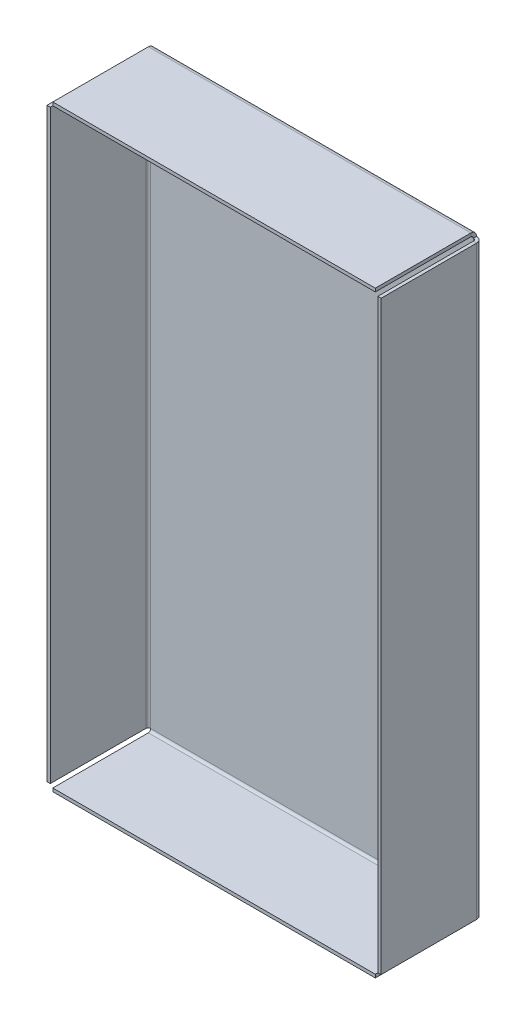
from build123d import *

# Parameters (mm, degrees)
BASE_FLANGE1_DEPTH         = 1
SKETCHED_START             = 31
SKETCHED_BEND1_DEPTH       = 178
SKETCHED_BEND1_2_DEPTH     = 98
SKETCHED_BEND1_3_DEPTH     = 178
SKETCHED_BEND1_4_OUTLINE_W = 98
SKETCHED_BEND1_4_OUTLINE_H = 1
SKETCHED_BEND1_4_DEPTH     = 29.234623369
SKETCHED_START_2           = 210.765376631
SKETCHED_BEND1_5_OUTLINE_W = 98
SKETCHED_BEND1_5_OUTLINE_H = 1
SKETCHED_BEND1_5_DEPTH     = 29.234623369
SKETCHED_BEND1_6_DEPTH     = 98
SKETCHED_BEND1_7_OUTLINE_W = 178
SKETCHED_BEND1_7_OUTLINE_H = 1
SKETCHED_BEND1_7_DEPTH     = 29.234623369
SKETCHED_START_3           = 130.765376631
SKETCHED_BEND1_8_OUTLINE_W = 178
SKETCHED_BEND1_8_OUTLINE_H = 1
SKETCHED_BEND1_8_DEPTH     = 29.234623369


# Read off the part's stored shape, not the designer's step: Sketched Bend1
# Sheet-metal steps are written as plain solids
with BuildPart() as part:
    # Sketch1 → Base-Flange1 (new body)
    with BuildSketch(Plane.XY):
        Polygon((0, 209), (31, 209), (31, 240), (129, 240), (129, 209), (160, 209), (160, 31), (129, 31), (129, 0), (31, 0), (31, 31), (0, 31), align=None)
    extrude(amount=-BASE_FLANGE1_DEPTH)

    # Sketched Bend1 outline → Sketched Bend1 (add)
    with BuildSketch(Plane(origin=(0, 0, 0), x_dir=(1, 0, 0), z_dir=(0, 1, 0)).offset(SKETCHED_START)):
        with BuildLine():
            Line((29.234623369, -0.7366), (29.234623369, -29.765376631))
            Line((29.234623369, -29.765376631), (30.234623369, -29.765376631))
            Line((30.234623369, -29.765376631), (30.234623369, -0.7366))
            ThreePointArc((30.234623369, -0.7366), (30.450368514, -0.215745145), (30.971223369, 0))
            Line((30.971223369, 0), (29.398582279, 0))
            ThreePointArc((29.398582279, 0), (29.276108612, -0.359286442), (29.234623369, -0.7366))
        make_face()
        with BuildLine():
            Line((130.601417721, 0), (129.028776631, 0))
            ThreePointArc((129.028776631, 0), (129.549631486, -0.215745145), (129.765376631, -0.7366))
            Line((129.765376631, -0.7366), (129.765376631, -29.765376631))
            Line((129.765376631, -29.765376631), (130.765376631, -29.765376631))
            Line((130.765376631, -29.765376631), (130.765376631, -0.7366))
            ThreePointArc((130.765376631, -0.7366), (130.723891388, -0.359286442), (130.601417721, 0))
        make_face()
    extrude(amount=SKETCHED_BEND1_DEPTH)

    # Sketched Bend1 2 outline → Sketched Bend1 2 (add)
    with BuildSketch(Plane.YZ.offset(SKETCHED_START)):
        with BuildLine():
            Line((209.028776631, 0), (210.601417721, 0))
            ThreePointArc((210.601417721, 0), (210.723891388, 0.359286442), (210.765376631, 0.7366))
            Line((210.765376631, 0.7366), (210.765376631, 29.765376631))
            Line((210.765376631, 29.765376631), (209.765376631, 29.765376631))
            Line((209.765376631, 29.765376631), (209.765376631, 0.7366))
            ThreePointArc((209.765376631, 0.7366), (209.549631486, 0.215745145), (209.028776631, 0))
        make_face()
        with BuildLine():
            ThreePointArc((29.234623369, 0.7366), (29.276108612, 0.359286442), (29.398582279, 0))
            Line((29.398582279, 0), (30.971223369, 0))
            ThreePointArc((30.971223369, 0), (30.450368514, 0.215745145), (30.234623369, 0.7366))
            Line((30.234623369, 0.7366), (30.234623369, 29.765376631))
            Line((30.234623369, 29.765376631), (29.234623369, 29.765376631))
            Line((29.234623369, 29.765376631), (29.234623369, 0.7366))
        make_face()
    extrude(amount=SKETCHED_BEND1_2_DEPTH)

    # Sketched Bend1 3 outline → Sketched Bend1 3 (cut)
    with BuildSketch(Plane(origin=(0, 0, 0), x_dir=(1, 0, 0), z_dir=(0, 1, 0)).offset(SKETCHED_START)):
        with BuildLine():
            Line((0, 0), (29.398582279, 0))
            ThreePointArc((29.398582279, 0), (30.039397205, 0.728828115), (30.971223369, 1))
            Line((30.971223369, 1), (0, 1))
            Line((0, 1), (0, 0))
        make_face()
        with BuildLine():
            Line((160, 1), (129.028776631, 1))
            ThreePointArc((129.028776631, 1), (129.960602795, 0.728828115), (130.601417721, 0))
            Line((130.601417721, 0), (160, 0))
            Line((160, 0), (160, 1))
        make_face()
    extrude(amount=SKETCHED_BEND1_3_DEPTH, mode=Mode.SUBTRACT)

    # Sketched Bend1 4 outline → Sketched Bend1 4 (cut)
    with BuildSketch(Plane(origin=(0, 0, 0), x_dir=(1, 0, 0), z_dir=(0, 1, 0))):
        with Locations((80, 0.5)):
            Rectangle(SKETCHED_BEND1_4_OUTLINE_W, SKETCHED_BEND1_4_OUTLINE_H)
    extrude(amount=SKETCHED_BEND1_4_DEPTH, mode=Mode.SUBTRACT)

    # Sketched Bend1 5 outline → Sketched Bend1 5 (cut)
    with BuildSketch(Plane(origin=(0, 0, 0), x_dir=(1, 0, 0), z_dir=(0, 1, 0)).offset(SKETCHED_START_2)):
        with Locations((80, 0.5)):
            Rectangle(SKETCHED_BEND1_5_OUTLINE_W, SKETCHED_BEND1_5_OUTLINE_H)
    extrude(amount=SKETCHED_BEND1_5_DEPTH, mode=Mode.SUBTRACT)

    # Sketched Bend1 6 outline → Sketched Bend1 6 (cut)
    with BuildSketch(Plane.YZ.offset(SKETCHED_START)):
        with BuildLine():
            ThreePointArc((210.601417721, 0), (209.960602795, -0.728828115), (209.028776631, -1))
            Line((209.028776631, -1), (240, -1))
            Line((240, -1), (240, 0))
            Line((240, 0), (210.601417721, 0))
        make_face()
        with BuildLine():
            Line((0, -1), (30.971223369, -1))
            ThreePointArc((30.971223369, -1), (30.039397205, -0.728828115), (29.398582279, 0))
            Line((29.398582279, 0), (0, 0))
            Line((0, 0), (0, -1))
        make_face()
    extrude(amount=SKETCHED_BEND1_6_DEPTH, mode=Mode.SUBTRACT)

    # Sketched Bend1 7 outline → Sketched Bend1 7 (cut)
    with BuildSketch(Plane.YZ):
        with Locations((120, -0.5)):
            Rectangle(SKETCHED_BEND1_7_OUTLINE_W, SKETCHED_BEND1_7_OUTLINE_H)
    extrude(amount=SKETCHED_BEND1_7_DEPTH, mode=Mode.SUBTRACT)

    # Sketched Bend1 8 outline → Sketched Bend1 8 (cut)
    with BuildSketch(Plane.YZ.offset(SKETCHED_START_3)):
        with Locations((120, -0.5)):
            Rectangle(SKETCHED_BEND1_8_OUTLINE_W, SKETCHED_BEND1_8_OUTLINE_H)
    extrude(amount=SKETCHED_BEND1_8_DEPTH, mode=Mode.SUBTRACT)


solid = part.part
